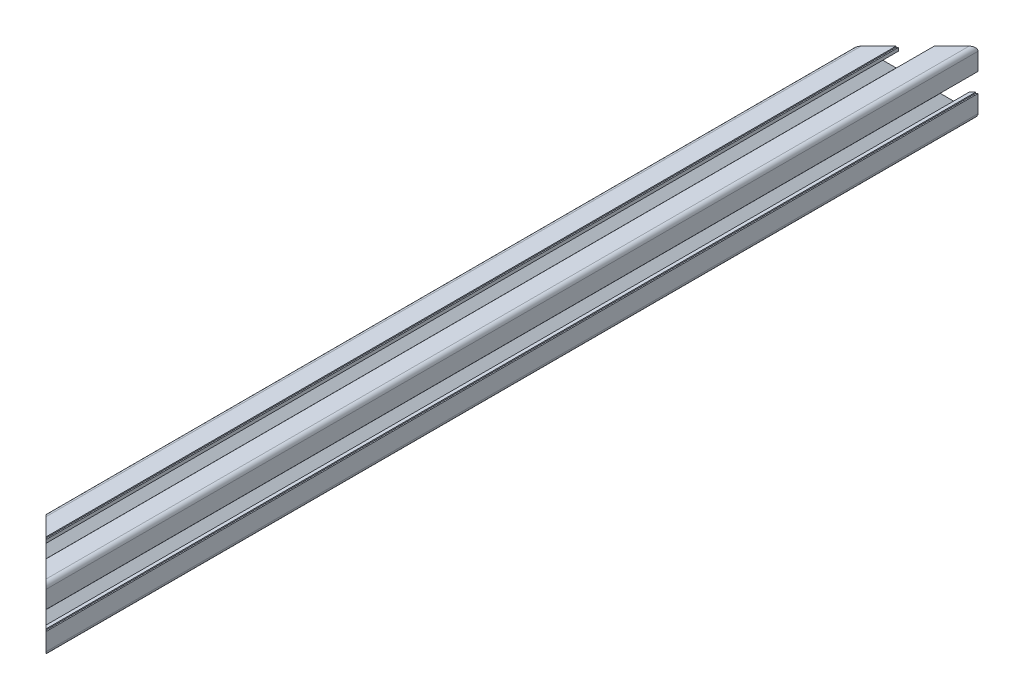
from build123d import *

# Parameters (mm, degrees)
BOSS_EXTRUDE1_DEPTH     = 444.5
CUT_EXTRUDE1_DEPTH      = 446.005898837
CUT_EXTRUDE1_DEPTH_BACK = 446.005898837
CUT_EXTRUDE2_DEPTH      = 446.76367057


with BuildPart() as part:
    # Sketch4 → Boss-Extrude1 (new body)
    with BuildSketch(Plane.XY):
        with BuildLine():
            Line((0, -5.45), (0.655464476, -6))
            Line((0.655464476, -6), (4.504469158, -6))
            Line((4.504469158, -6), (8.25, -9.745530842))
            Line((8.25, -9.745530842), (8.25, -12.885))
            Line((8.25, -12.885), (4, -12.885))
            Line((4, -12.885), (4, -14.45))
            Line((4, -14.45), (4.55, -14.45))
            Line((4.55, -14.45), (4.55, -15))
            Line((4.55, -15), (12.885, -15))
            ThreePointArc((12.885, -15), (14.380530842, -14.380530842), (15, -12.885))
            Line((15, -12.885), (15, -4.55))
            Line((15, -4.55), (14.45, -4.55))
            Line((14.45, -4.55), (14.45, -4))
            Line((14.45, -4), (12.885, -4))
            Line((12.885, -4), (12.885, -8.25))
            Line((12.885, -8.25), (9.745530842, -8.25))
            Line((9.745530842, -8.25), (6, -4.504469158))
            Line((6, -4.504469158), (6, -0.655464476))
            Line((6, -0.655464476), (5.45, 0))
            Line((5.45, 0), (3.5, 0))
            ThreePointArc((3.5, 0), (3.371433308, -0.939913534), (2.995178599, -1.81077474))
            Line((2.995178599, -1.81077474), (4.675743591, -3.491339732))
            Line((4.675743591, -3.491339732), (3.491339732, -4.675743591))
            Line((3.491339732, -4.675743591), (1.81077474, -2.995178599))
            ThreePointArc((1.81077474, -2.995178599), (0.939913534, -3.371433308), (0, -3.5))
            Line((0, -3.5), (0, -5.45))
        make_face()
        with BuildLine():
            Line((9.375, -10.365), (9.375, -12.885))
            ThreePointArc((9.375, -12.885), (9.664964287, -13.585035713), (10.365, -13.875))
            Line((10.365, -13.875), (12.885, -13.875))
            ThreePointArc((12.885, -13.875), (13.585035713, -13.585035713), (13.875, -12.885))
            Line((13.875, -12.885), (13.875, -10.365))
            ThreePointArc((13.875, -10.365), (13.585035713, -9.664964287), (12.885, -9.375))
            Line((12.885, -9.375), (10.365, -9.375))
            ThreePointArc((10.365, -9.375), (9.664964287, -9.664964287), (9.375, -10.365))
        make_face(mode=Mode.SUBTRACT)
    extrude(amount=BOSS_EXTRUDE1_DEPTH)

    # Mirror1: part across plane


with BuildPart() as part_1:
    add(part.part)
    add(part.part.mirror(Plane(origin=(0, 0, 0), x_dir=(0, 0, 1), z_dir=(1, 0, 0))))

    # Mirror2: part across plane


with BuildPart() as part_2:
    add(part_1.part)
    add(part_1.part.mirror(Plane.ZX))

    # Sketch5 → Cut-Extrude1 (cut, two sides: drawn at the far end of the back side and taken through both)
    with BuildSketch(Plane.XY.offset(444.5).offset(-CUT_EXTRUDE1_DEPTH_BACK)):
        Polygon((-5.675, 12.885), (-5.4, 13.16), (-5.125, 12.885), align=None)
    extrude(amount=CUT_EXTRUDE1_DEPTH + CUT_EXTRUDE1_DEPTH_BACK, mode=Mode.SUBTRACT)

    # Sketch6 → Cut-Extrude2 (cut, through all)
    with BuildSketch(Plane.XZ.offset(15)):
        Polygon((15, 444.5), (-15, 444.5), (-15, 414.5), align=None)
        Polygon((15, 0), (-15, 0), (-15, 30), align=None)
    extrude(amount=-CUT_EXTRUDE2_DEPTH, mode=Mode.SUBTRACT)


solid = part_2.part
